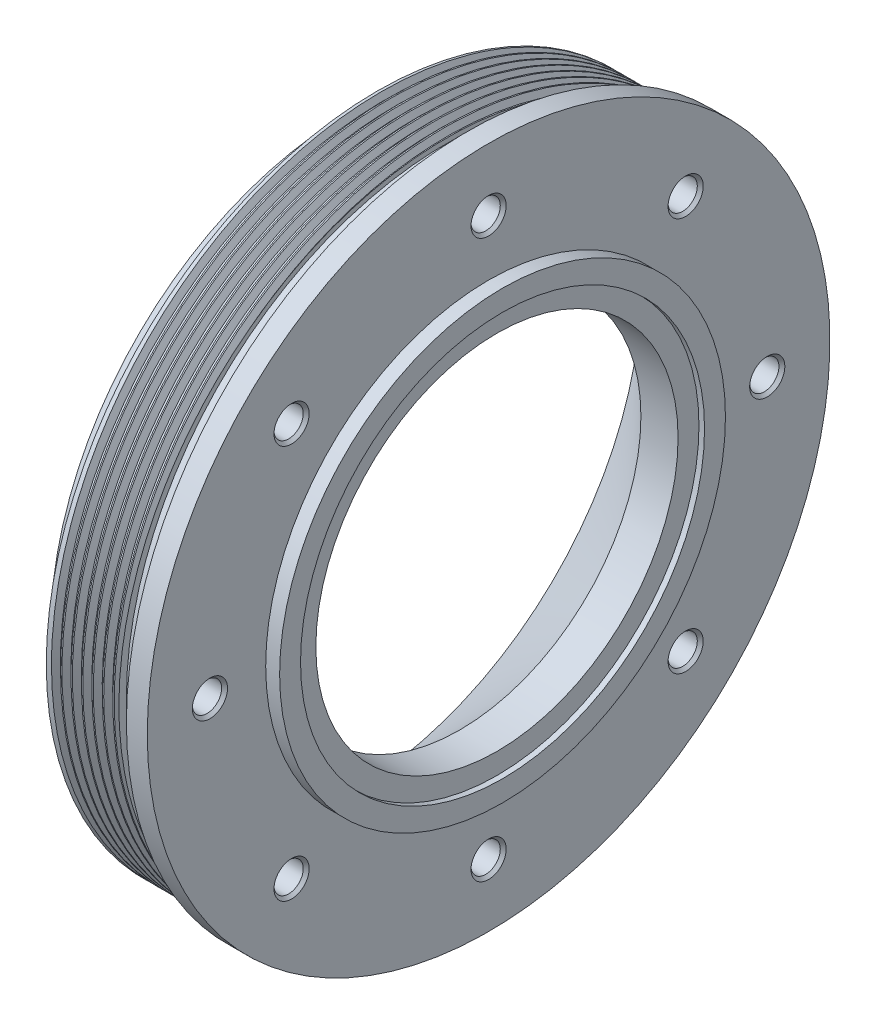
from build123d import *

# Parameters (mm, degrees)
CIRPATTERN1_COUNT = 8
THREAD1_PITCH     = 1.5


with BuildPart() as part:
    # Sketch1 → Revolve1 (revolve)
    with BuildSketch(Plane.XY, mode=Mode.PRIVATE) as revolve1_sk:
        Polygon((0, 42.865), (0, 41.865), (15.865, 26), (21.2, 26), (21.2, 29), (22, 29), (22, 32), (20, 32), (20, 49), (17, 49), (17, 46), (14, 46), (14, 47.5), (4, 47.5), (4, 42.865), align=None)
    revolve(revolve1_sk.sketch.rotate(Axis((0, 0, 0), (1, 0, 0)), 90), axis=Axis((0, 0, 0), (1, 0, 0)))

    # Sketch3 → M5 Tapped Hole1 (revolve, cut)
    with BuildSketch(Plane(origin=(20, 0, -40), x_dir=(0, 0, -1), z_dir=(0, 1, 0))):
        Polygon((0, 0), (0, 11.2618073), (2.1, 10), (2.1, 0.425), (2.525, 0), align=None)
    m5_tapped_hole1 = revolve(axis=Axis((26.35, 0, -40), (-1, 0, 0)), mode=Mode.SUBTRACT)

    # CirPattern1: M5 Tapped Hole1 ×8 about axis
    cirpattern1_axis = Axis((0, 0, 0), (1, 0, 0))
    for i in range(1, CIRPATTERN1_COUNT):
        add(m5_tapped_hole1.rotate(cirpattern1_axis, i * 360 / CIRPATTERN1_COUNT), mode=Mode.SUBTRACT)

    # Thread1: the profile of Thread Profile1 profile screwed along a right-hand helix of 6.666667 turns, 8 arcs to a turn; built about Z, then put on its axis
    thread1_z = Axis((0, 0, 0), (0, 0, 1))
    thread1_corners = [(47.5003, 0, -0.000173205), (47.5003, 0, 1.312673201), (46.688101188, 0, 0.843749998), (46.688101188, 0, 0.468749998)]
    with BuildLine(mode=Mode.PRIVATE) as thread1_profile:
        Line(thread1_corners[0], thread1_corners[1])
        Line(thread1_corners[1], thread1_corners[2])
        Line(thread1_corners[2], thread1_corners[3])
        Line(thread1_corners[3], thread1_corners[0])
    thread1_cap = Face(thread1_profile.wire())
    thread1_turn_angles = [0, 22.5, 45, 67.5, 90, 112.5, 135, 157.5, 180, 202.5, 225, 247.5, 270, 292.5, 315, 337.5, 360]
    thread1_turn_weights = [1, 0.9238795325112867, 1, 0.9238795325112867, 1, 0.9238795325112867, 1, 0.9238795325112867, 1, 0.9238795325112867, 1, 0.9238795325112867, 1, 0.9238795325112867, 1, 0.9238795325112867, 1]
    thread1_turn_rails = [Edge.make_bspline([Vector(p[0], p[1], 0).rotate(thread1_z, thread1_turn_angles[k]) / thread1_turn_weights[k] + Vector(0, 0, p[2] + THREAD1_PITCH * thread1_turn_angles[k] / 360) for k in range(17)], [0, 0, 0, 1, 1, 2, 2, 3, 3, 4, 4, 5, 5, 6, 6, 7, 7, 8, 8, 8], 2, thread1_turn_weights) for p in thread1_corners]
    thread1_turn_sides = [Face.make_surface_from_curves(thread1_turn_rails[p[0]], thread1_turn_rails[p[1]]) for p in [(0, 1), (1, 2), (2, 3), (3, 0)]]
    thread1_last_angles = [2160, 2182.5, 2205, 2227.5, 2250, 2272.5, 2295, 2317.5, 2340, 2362.5, 2385, 2392.5, 2400]
    thread1_last_weights = [1, 0.9238795325112867, 1, 0.9238795325112867, 1, 0.9238795325112867, 1, 0.9238795325112867, 1, 0.9238795325112867, 1, 0.9914448613738109, 1]
    thread1_last_rails = [Edge.make_bspline([Vector(p[0], p[1], 0).rotate(thread1_z, thread1_last_angles[k]) / thread1_last_weights[k] + Vector(0, 0, p[2] + THREAD1_PITCH * thread1_last_angles[k] / 360) for k in range(13)], [0, 0, 0, 1, 1, 2, 2, 3, 3, 4, 4, 5, 5, 6, 6, 6], 2, thread1_last_weights) for p in thread1_corners]
    thread1_last_sides = [Face.make_surface_from_curves(thread1_last_rails[p[0]], thread1_last_rails[p[1]]) for p in [(0, 1), (1, 2), (2, 3), (3, 0)]]
    thread1 = Plane(origin=(4, 0, 0), x_dir=(0, 0, -1), z_dir=(1, 0, 0)) * Solid(Shell([*[p.moved(Location((0, 0, THREAD1_PITCH * i))) for i in range(6) for p in thread1_turn_sides], *thread1_last_sides, thread1_cap, thread1_cap.rotate(thread1_z, 2400).moved(Location((0, 0, THREAD1_PITCH * 2400 / 360)))]))
    add(thread1, mode=Mode.SUBTRACT)


solid = part.part
